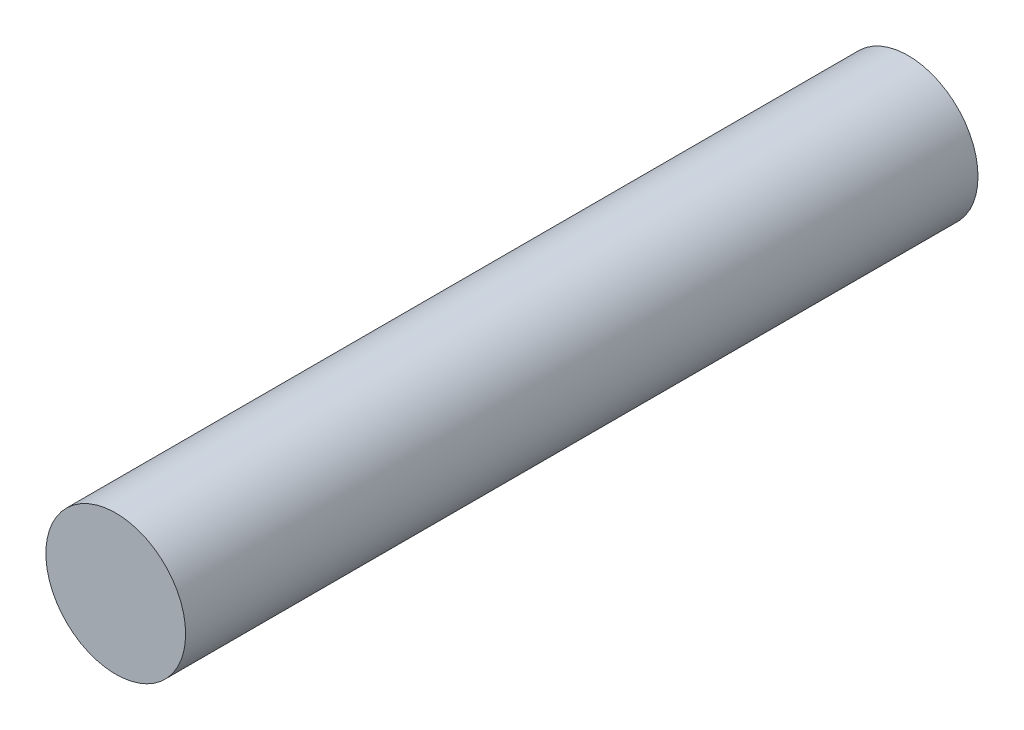
from build123d import *

# Parameters (mm, degrees)
SKETCH1_R           = 5
BOSS_EXTRUDE1_DEPTH = 56.7


with BuildPart() as part:
    # Sketch1 → Boss-Extrude1 (new body)
    with BuildSketch(Plane.XY):
        Circle(SKETCH1_R)
    extrude(amount=BOSS_EXTRUDE1_DEPTH)


solid = part.part
